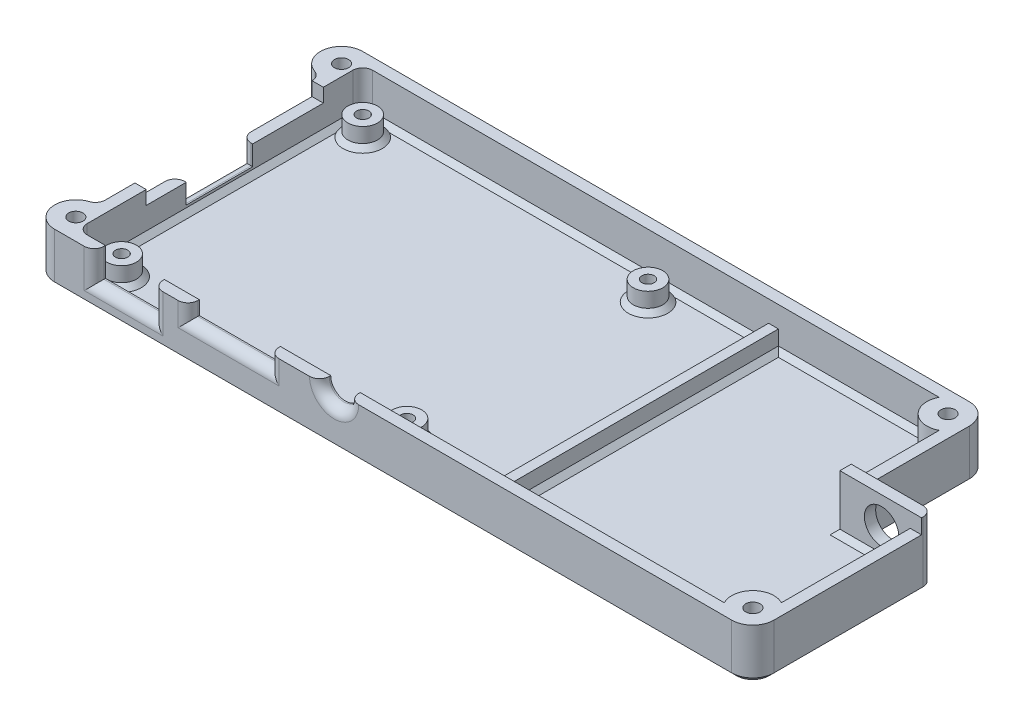
from build123d import *

# Parameters (mm, degrees)
BOSS_EXTRUDE1_DEPTH            = 10.3
BOSS_EXTRUDE2_DEPTH            = 2
SKETCH6_R                      = 3
BOSS_EXTRUDE3_DEPTH            = 4
F_2_5_2_5_DIAMETER_HOLE1_D     = 2.5
F_2_5_2_5_DIAMETER_HOLE1_DEPTH = 8
F_2_5_2_5_DIAMETER_HOLE1_TIP   = 0.751075774
SKETCH10_W                     = 2
SKETCH10_H                     = 58
BOSS_EXTRUDE4_DEPTH            = 4
CUT_EXTRUDE1_REACH             = 100.128
SKETCH11_R                     = 3
SKETCH11_W                     = 12
SKETCH11_H                     = 5.8
SKETCH11_W_2                   = 16.5
SKETCH11_H_2                   = 2.8
CUT_EXTRUDE2_REACH             = 148.374
SKETCH12_W                     = 13.5
SKETCH12_H                     = 6.8
SKETCH12_W_2                   = 36
SKETCH12_H_2                   = 2.8
FILLET6_R                      = 2
FILLET8_R                      = 2
CHAMFER1_SIZE                  = 1
FILLET9_R                      = 2
SKETCH14_W                     = 16.6
SKETCH14_H                     = 2.3
BOSS_EXTRUDE5_DEPTH            = 3
CUT_EXTRUDE3_REACH             = 86.384
SKETCH13_R                     = 3.5
BOSS_EXTRUDE6_DEPTH            = 10.3
F_2_9_2_9_DIAMETER_HOLE2_D     = 2.9
F_2_9_2_9_DIAMETER_HOLE1_D     = 2.9
BOSS_EXTRUDE7_REACH            = 89.052
SKETCH24_R                     = 4.3
F_2_9_2_9_DIAMETER_HOLE3_D     = 2.9
F_2_9_2_9_DIAMETER_HOLE4_D     = 2.9
FILLET10_R                     = 4.3
FILLET16_R                     = 4.3
FILLET17_R                     = 2
FILLET18_R                     = 2
CHAMFER3_SIZE                  = 1
FILLET19_R                     = 2


with BuildPart() as part:
    # Sketch3 → Boss-Extrude1 (new body)
    with BuildSketch(Plane(origin=(0, 0, 0), x_dir=(1, 0, 0), z_dir=(0, 1, 0))):
        Polygon((52.738233838, 8.405993834), (67.038233838, 8.405993834), (67.038233838, -28.194006166), (52.738233838, -28.194006166), (-74.861766162, -28.194006166), (-74.861766162, 34.405993834), (52.738233838, 34.405993834), align=None)
        Polygon((55.038233838, -25.894006166), (64.738233838, -25.894006166), (64.738233838, 6.105993834), (50.438233838, 6.105993834), (50.438233838, 32.105993834), (-72.561766162, 32.105993834), (-72.561766162, -25.894006166), (50.438233838, -25.894006166), align=None, mode=Mode.SUBTRACT)
    extrude(amount=BOSS_EXTRUDE1_DEPTH)

    # Sketch5 → Boss-Extrude2 (add)
    with BuildSketch(Plane(origin=(0, 0, 0), x_dir=(1, 0, 0), z_dir=(0, 1, 0))):
        Polygon((-72.561766162, 32.105993834), (50.438233838, 32.105993834), (50.438233838, 6.105993834), (64.738233838, 6.105993834), (64.738233838, -25.894006166), (50.438233838, -25.894006166), (-72.561766162, -25.894006166), align=None)
    extrude(amount=BOSS_EXTRUDE2_DEPTH)

    # Sketch6 → Boss-Extrude3 (add)
    with BuildSketch(Plane(origin=(0, 2, 0), x_dir=(1, 0, 0), z_dir=(0, 1, 0))):
        with Locations(Location((-68.061766162, 27.605993834, 0), (0, 0, 270))):
            Circle(SKETCH6_R)
        with Locations(Location((-68.061766162, -21.394006166, 0), (0, 0, 270))):
            Circle(SKETCH6_R)
        with Locations(Location((-10.061766162, -21.394006166, 0), (0, 0, 270))):
            Circle(SKETCH6_R)
        with Locations(Location((-10.061766162, 27.605993834, 0), (0, 0, 270))):
            Circle(SKETCH6_R)
    extrude(amount=BOSS_EXTRUDE3_DEPTH)

    # Ø2.5 (2.5) Diameter Hole1
    with Locations(Plane(origin=(0, 6, 0), x_dir=(1, 0, 0), z_dir=(0, 1, 0))):
        with Locations((-68.061766162, 27.605993834), (-10.061766162, 27.605993834), (-10.061766162, -21.394006166), (-68.061766162, -21.394006166)):
            Hole(F_2_5_2_5_DIAMETER_HOLE1_D / 2, depth=F_2_5_2_5_DIAMETER_HOLE1_DEPTH)
            with Locations((0, 0, -(F_2_5_2_5_DIAMETER_HOLE1_DEPTH + F_2_5_2_5_DIAMETER_HOLE1_TIP / 2))):  # 118° drill point
                Cone(0, F_2_5_2_5_DIAMETER_HOLE1_D / 2, F_2_5_2_5_DIAMETER_HOLE1_TIP, mode=Mode.SUBTRACT)

    # Sketch10 → Boss-Extrude4 (add)
    with BuildSketch(Plane(origin=(0, 2, 0), x_dir=(1, 0, 0), z_dir=(0, 1, 0))):
        with Locations((10.938233838, 3.105993834)):
            Rectangle(SKETCH10_W, SKETCH10_H)
    extrude(amount=BOSS_EXTRUDE4_DEPTH)

    # Sketch11 → Cut-Extrude1 (cut, up to next)
    with BuildSketch(Plane.XY.offset(28.194006166), mode=Mode.PRIVATE) as cut_extrude1_sk1:
        with Locations((-18.061766162, 10.3)):
            Circle(SKETCH11_R)
    cut_extrude1_tool1 = extrude(cut_extrude1_sk1.sketch, amount=-CUT_EXTRUDE1_REACH, mode=Mode.PRIVATE) & part.part
    # Sketch11 → Cut-Extrude1 (cut, up to next)
    with BuildSketch(Plane.XY.offset(28.194006166), mode=Mode.PRIVATE) as cut_extrude1_sk2:
        with Locations((-60.861766162, 7.4)):
            Rectangle(SKETCH11_W, SKETCH11_H)
    cut_extrude1_tool2 = extrude(cut_extrude1_sk2.sketch, amount=-CUT_EXTRUDE1_REACH, mode=Mode.PRIVATE) & part.part
    # Sketch11 → Cut-Extrude1 (cut, up to next)
    with BuildSketch(Plane.XY.offset(28.194006166), mode=Mode.PRIVATE) as cut_extrude1_sk3:
        with Locations((-39.527982648, 8.9)):
            Rectangle(SKETCH11_W_2, SKETCH11_H_2)
    cut_extrude1_tool3 = extrude(cut_extrude1_sk3.sketch, amount=-CUT_EXTRUDE1_REACH, mode=Mode.PRIVATE) & part.part
    add(cut_extrude1_tool1.solids().sort_by_distance((-18.061766, 10.3, 28.194006))[0], mode=Mode.SUBTRACT)
    add(cut_extrude1_tool2.solids().sort_by_distance((-60.861766, 7.4, 28.194006))[0], mode=Mode.SUBTRACT)
    add(cut_extrude1_tool3.solids().sort_by_distance((-39.527983, 8.9, 28.194006))[0], mode=Mode.SUBTRACT)

    # Sketch12 → Cut-Extrude2 (cut, up to next)
    with BuildSketch(Plane.ZY.offset(74.861766162), mode=Mode.PRIVATE) as cut_extrude2_sk1:
        with Locations((-2.982922372, 6.9)):
            Rectangle(SKETCH12_W, SKETCH12_H)
    cut_extrude2_tool1 = extrude(cut_extrude2_sk1.sketch, amount=-CUT_EXTRUDE2_REACH, mode=Mode.PRIVATE) & part.part
    # Sketch12 → Cut-Extrude2 (cut, up to next)
    with BuildSketch(Plane.ZY.offset(74.861766162), mode=Mode.PRIVATE) as cut_extrude2_sk2:
        with Locations((-6.105993834, 8.9)):
            Rectangle(SKETCH12_W_2, SKETCH12_H_2)
    cut_extrude2_tool2 = extrude(cut_extrude2_sk2.sketch, amount=-CUT_EXTRUDE2_REACH, mode=Mode.PRIVATE) & part.part
    add(cut_extrude2_tool1.solids().sort_by_distance((-74.861766, 6.9, -2.982922))[0], mode=Mode.SUBTRACT)
    add(cut_extrude2_tool2.solids().sort_by_distance((-74.861766, 8.9, -6.105994))[0], mode=Mode.SUBTRACT)

    # Fillet6
    fillet6_edges = [part.edges().sort_by_distance(p)[0] for p in [
        (50.438233838, 6.15, -32.105993834),
    ]]
    fillet(fillet6_edges, radius=FILLET6_R)

    # Fillet8
    fillet8_edges = [part.edges().sort_by_distance(p)[0] for p in [
        (-72.561766162, 6.15, -32.105993834),
        (-72.561766162, 6.15, 25.894006166),
    ]]
    fillet(fillet8_edges, radius=FILLET8_R)

    # Chamfer1
    chamfer1_edges = [part.edges().sort_by_distance(p)[0] for p in [
        (-68.061766162, 2, -30.605993834),
        (-68.061766162, 2, 18.394006166),
        (-10.061766162, 2, 18.394006166),
        (-10.061766162, 2, -30.605993834),
    ]]
    chamfer(chamfer1_edges, length=CHAMFER1_SIZE)

    # Chamfer2
    # the kernel refuses this chamfer: 1 mm, written as the material it adds along each edge
    with BuildSketch(Plane(origin=(64.738233838, 2, 25.894006166), x_dir=(0, 0.9996219169112968, 0.027495876610585623), z_dir=(-1, 0, 0))) as chamfer2_piece_1:
        with BuildLine():
            Line((1.028673195, 0), (-0.056547155, 1.027117794))
            Line((-0.056547155, 1.027117794), (-0.076539593, 1.026567876))
            ThreePointArc((-0.076539593, 1.026567876), (-0.034129227, 0.51339783), (-0.019992438, -0.000549918))
            Line((-0.019992438, -0.000549918), (0.000549918, -0.019992438))
            ThreePointArc((0.000549918, -0.019992438), (0.514497665, -0.00585565), (1.029223113, -0.019992438))
            Line((1.029223113, -0.019992438), (1.028673195, 0))
        make_face()
    extrude(amount=52.8)
    with BuildSketch(Plane(origin=(-70.561766162, 2, -32.105993834), x_dir=(0, -0.027495876610586296, 0.9996219169112968), z_dir=(1, 0, 0)), Plane(origin=(9.938233838, 2, 25.894006166), x_dir=(0, -0.02749587661058759, -0.9996219169112968), z_dir=(-1, 0, 0))) as chamfer2_piece_2:
        with BuildLine():
            Line((1.028673195, 0), (-0.056547155, -1.027117794))
            Line((-0.056547155, -1.027117794), (-0.076539593, -1.026567876))
            ThreePointArc((-0.076539593, -1.026567876), (-0.034129227, -0.51339783), (-0.019992438, 0.000549918))
            Line((-0.019992438, 0.000549918), (0.000549918, 0.019992438))
            ThreePointArc((0.000549918, 0.019992438), (0.514497665, 0.00585565), (1.029223113, 0.019992438))
            Line((1.029223113, 0.019992438), (1.028673195, 0))
        make_face()
    extrude(amount=80.5)
    with BuildSketch(Plane(origin=(9.938233838, 2, 25.894006166), x_dir=(-0.9996219169112968, -0.027495876610586556, 0), z_dir=(0, 0, -1))) as chamfer2_piece_3:
        with BuildLine():
            Line((1.028673195, 0), (-0.056547155, 1.027117794))
            Line((-0.056547155, 1.027117794), (-0.076539593, 1.026567876))
            ThreePointArc((-0.076539593, 1.026567876), (-0.034129227, 0.51339783), (-0.019992438, -0.000549918))
            Line((-0.019992438, -0.000549918), (0.000549918, -0.019992438))
            ThreePointArc((0.000549918, -0.019992438), (0.514497665, -0.00585565), (1.029223113, -0.019992438))
            Line((1.029223113, -0.019992438), (1.028673195, 0))
        make_face()
    extrude(amount=58)
    with BuildSketch(Plane(origin=(11.938233838, 2, -32.105993834), x_dir=(-0.027495876610585623, 0.9996219169112968, 0), z_dir=(0, 0, 1))) as chamfer2_piece_4:
        with BuildLine():
            Line((1.028673195, 0), (-0.056547155, -1.027117794))
            Line((-0.056547155, -1.027117794), (-0.076539593, -1.026567876))
            ThreePointArc((-0.076539593, -1.026567876), (-0.034129227, -0.51339783), (-0.019992438, 0.000549918))
            Line((-0.019992438, 0.000549918), (0.000549918, 0.019992438))
            ThreePointArc((0.000549918, 0.019992438), (0.514497665, 0.00585565), (1.029223113, 0.019992438))
            Line((1.029223113, 0.019992438), (1.028673195, 0))
        make_face()
    extrude(amount=58)
    with BuildSketch(Plane(origin=(11.938233838, 2, -32.105993834), x_dir=(0, 0.999621916911297, -0.027495876610582174), z_dir=(1, 0, 0))) as chamfer2_piece_5:
        with BuildLine():
            Line((1.028673195, 0), (-0.056547155, 1.027117794))
            Line((-0.056547155, 1.027117794), (-0.076539593, 1.026567876))
            ThreePointArc((-0.076539593, 1.026567876), (-0.034129227, 0.51339783), (-0.019992438, -0.000549918))
            Line((-0.019992438, -0.000549918), (0.000549918, -0.019992438))
            ThreePointArc((0.000549918, -0.019992438), (0.514497665, -0.00585565), (1.029223113, -0.019992438))
            Line((1.029223113, -0.019992438), (1.028673195, 0))
        make_face()
    extrude(amount=36.5)
    with BuildSketch(Plane(origin=(48.438233838, 2, -30.105993834), x_dir=(0, 0, -1), z_dir=(-1, 0, 0))) as chamfer2_piece_6:
        with BuildLine():
            Line((0.971715729, 0.028284271), (2.028284271, -1.028284271))
            Line((2.028284271, -1.028284271), (2.048284271, -1.028284271))
            ThreePointArc((2.048284271, -1.028284271), (2.02, -0.514142136), (2.02, 0))
            Line((2.02, 0), (2, 0.02))
            ThreePointArc((2, 0.02), (1.485857864, 0.02), (0.971715729, 0.048284271))
            Line((0.971715729, 0.048284271), (0.971715729, 0.028284271))
        make_face()
    revolve(axis=Axis((48.438233838, 2, -30.105993834), (0, -1, 0)), revolution_arc=90)
    with BuildSketch(Plane(origin=(-72.561766162, 2, 23.894006166), x_dir=(0.9996219169112968, -0.027495876610586605, 0), z_dir=(0, 0, -1))) as chamfer2_piece_7:
        with BuildLine():
            Line((1.028673195, 0), (-0.056547155, -1.027117794))
            Line((-0.056547155, -1.027117794), (-0.076539593, -1.026567876))
            ThreePointArc((-0.076539593, -1.026567876), (-0.034129227, -0.51339783), (-0.019992438, 0.000549918))
            Line((-0.019992438, 0.000549918), (0.000549918, 0.019992438))
            ThreePointArc((0.000549918, 0.019992438), (0.514497665, 0.00585565), (1.029223113, 0.019992438))
            Line((1.029223113, 0.019992438), (1.028673195, 0))
        make_face()
    extrude(amount=54)
    with BuildSketch(Plane(origin=(-70.561766162, 2, -30.105993834), x_dir=(0, 0, -1), z_dir=(1, 0, 0))) as chamfer2_piece_8:
        with BuildLine():
            Line((0.971715729, -0.028284271), (2.028284271, 1.028284271))
            Line((2.028284271, 1.028284271), (2.048284271, 1.028284271))
            ThreePointArc((2.048284271, 1.028284271), (2.02, 0.514142136), (2.02, 0))
            Line((2.02, 0), (2, -0.02))
            ThreePointArc((2, -0.02), (1.485857864, -0.02), (0.971715729, -0.048284271))
            Line((0.971715729, -0.048284271), (0.971715729, -0.028284271))
        make_face()
    revolve(axis=Axis((-70.561766162, 2, -30.105993834), (0, 1, 0)), revolution_arc=90)
    with BuildSketch(Plane(origin=(-70.561766162, 2, 23.894006166), x_dir=(-1, 0, 0), z_dir=(0, 0, -1))) as chamfer2_piece_9:
        with BuildLine():
            Line((0.971715729, -0.028284271), (2.028284271, 1.028284271))
            Line((2.028284271, 1.028284271), (2.048284271, 1.028284271))
            ThreePointArc((2.048284271, 1.028284271), (2.02, 0.514142136), (2.02, 0))
            Line((2.02, 0), (2, -0.02))
            ThreePointArc((2, -0.02), (1.485857864, -0.02), (0.971715729, -0.048284271))
            Line((0.971715729, -0.048284271), (0.971715729, -0.028284271))
        make_face()
    revolve(axis=Axis((-70.561766162, 2, 23.894006166), (0, 1, 0)), revolution_arc=90)
    with BuildSketch(Plane(origin=(64.738233838, 2, -6.105993834), x_dir=(-0.9996219169112968, -0.027495876610586008, 0), z_dir=(0, 0, 1))) as chamfer2_piece_10:
        with BuildLine():
            Line((1.028673195, 0), (-0.056547155, -1.027117794))
            Line((-0.056547155, -1.027117794), (-0.076539593, -1.026567876))
            ThreePointArc((-0.076539593, -1.026567876), (-0.034129227, -0.51339783), (-0.019992438, 0.000549918))
            Line((-0.019992438, 0.000549918), (0.000549918, 0.019992438))
            ThreePointArc((0.000549918, 0.019992438), (0.514497665, 0.00585565), (1.029223113, 0.019992438))
            Line((1.029223113, 0.019992438), (1.028673195, 0))
        make_face()
    extrude(amount=32)
    with BuildSketch(Plane(origin=(50.438233838, 2, -6.105993834), x_dir=(0, -0.02749587661058627, 0.9996219169112968), z_dir=(1, 0, 0))) as chamfer2_piece_11:
        with BuildLine():
            Line((1.028673195, 0), (-0.056547155, -1.027117794))
            Line((-0.056547155, -1.027117794), (-0.076539593, -1.026567876))
            ThreePointArc((-0.076539593, -1.026567876), (-0.034129227, -0.51339783), (-0.019992438, 0.000549918))
            Line((-0.019992438, 0.000549918), (0.000549918, 0.019992438))
            ThreePointArc((0.000549918, 0.019992438), (0.514497665, 0.00585565), (1.029223113, 0.019992438))
            Line((1.029223113, 0.019992438), (1.028673195, 0))
        make_face()
    extrude(amount=14.3)
    with BuildSketch(Plane(origin=(50.438233838, 2, -30.105993834), x_dir=(-0.9996219169112968, -0.0274958766105862, 0), z_dir=(0, 0, 1))) as chamfer2_piece_12:
        with BuildLine():
            Line((1.028673195, 0), (-0.056547155, -1.027117794))
            Line((-0.056547155, -1.027117794), (-0.076539593, -1.026567876))
            ThreePointArc((-0.076539593, -1.026567876), (-0.034129227, -0.51339783), (-0.019992438, 0.000549918))
            Line((-0.019992438, 0.000549918), (0.000549918, 0.019992438))
            ThreePointArc((0.000549918, 0.019992438), (0.514497665, 0.00585565), (1.029223113, 0.019992438))
            Line((1.029223113, 0.019992438), (1.028673195, 0))
        make_face()
    extrude(amount=24)
    with BuildSketch(Plane(origin=(67.309916826, 2, 25.894006166), x_dir=(0, 0.9996219169112968, 0.027495876610585623), z_dir=(-1, 0, 0))) as chamfer2_piece_13a_section:
        with BuildLine():
            Line((1.028673195, 0), (-0.056547155, 1.027117794))
            Line((-0.056547155, 1.027117794), (-0.076539593, 1.026567876))
            ThreePointArc((-0.076539593, 1.026567876), (-0.034129227, 0.51339783), (-0.019992438, -0.000549918))
            Line((-0.019992438, -0.000549918), (0.000549918, -0.019992438))
            ThreePointArc((0.000549918, -0.019992438), (0.514497665, -0.00585565), (1.029223113, -0.019992438))
            Line((1.029223113, -0.019992438), (1.028673195, 0))
        make_face()
    chamfer2_piece_13a = extrude(amount=55.371682988, mode=Mode.PRIVATE)
    chamfer2_piece_13a = split(chamfer2_piece_13a, bisect_by=Plane(origin=(64.738233838, 2.329793627, 25.564212539), z_dir=(1, 0, 0)), keep=Keep.TOP, mode=Mode.PRIVATE)
    with BuildSketch(Plane(origin=(64.738233838, 2, -6.105993834), x_dir=(-0.9996219169112968, -0.027495876610586008, 0), z_dir=(0, 0, 1))) as chamfer2_piece_13b_section:
        with BuildLine():
            Line((1.028673195, 0), (-0.056547155, -1.027117794))
            Line((-0.056547155, -1.027117794), (-0.076539593, -1.026567876))
            ThreePointArc((-0.076539593, -1.026567876), (-0.034129227, -0.51339783), (-0.019992438, 0.000549918))
            Line((-0.019992438, 0.000549918), (0.000549918, 0.019992438))
            ThreePointArc((0.000549918, 0.019992438), (0.514497665, 0.00585565), (1.029223113, 0.019992438))
            Line((1.029223113, 0.019992438), (1.028673195, 0))
        make_face()
    chamfer2_piece_13b = extrude(amount=34.571682988, mode=Mode.PRIVATE)
    chamfer2_piece_13b = split(chamfer2_piece_13b, bisect_by=Plane(origin=(64.408440211, 2.329793627, 25.894006166), z_dir=(0, 0, 1)), keep=Keep.TOP, mode=Mode.PRIVATE)
    chamfer2_piece_13 = chamfer2_piece_13a & chamfer2_piece_13b
    add(chamfer2_piece_13)
    with BuildSketch(Plane(origin=(64.738233838, 2, 25.894006166), x_dir=(0, 0.9996219169112968, 0.027495876610585623), z_dir=(-1, 0, 0))) as chamfer2_piece_14a_section:
        with BuildLine():
            Line((1.028673195, 0), (-0.056547155, 1.027117794))
            Line((-0.056547155, 1.027117794), (-0.076539593, 1.026567876))
            ThreePointArc((-0.076539593, 1.026567876), (-0.034129227, 0.51339783), (-0.019992438, -0.000549918))
            Line((-0.019992438, -0.000549918), (0.000549918, -0.019992438))
            ThreePointArc((0.000549918, -0.019992438), (0.514497665, -0.00585565), (1.029223113, -0.019992438))
            Line((1.029223113, -0.019992438), (1.028673195, 0))
        make_face()
    chamfer2_piece_14a = extrude(amount=55.371682988, mode=Mode.PRIVATE)
    chamfer2_piece_14a = split(chamfer2_piece_14a, bisect_by=Plane(origin=(11.938233838, 2.329793627, 25.564212539), z_dir=(-1, 0, 0)), keep=Keep.TOP, mode=Mode.PRIVATE)
    with BuildSketch(Plane(origin=(11.938233838, 2, -32.105993834), x_dir=(-0.027495876610585623, 0.9996219169112968, 0), z_dir=(0, 0, 1))) as chamfer2_piece_14b_section:
        with BuildLine():
            Line((1.028673195, 0), (-0.056547155, -1.027117794))
            Line((-0.056547155, -1.027117794), (-0.076539593, -1.026567876))
            ThreePointArc((-0.076539593, -1.026567876), (-0.034129227, -0.51339783), (-0.019992438, 0.000549918))
            Line((-0.019992438, 0.000549918), (0.000549918, 0.019992438))
            ThreePointArc((0.000549918, 0.019992438), (0.514497665, 0.00585565), (1.029223113, 0.019992438))
            Line((1.029223113, 0.019992438), (1.028673195, 0))
        make_face()
    chamfer2_piece_14b = extrude(amount=60.571682988, mode=Mode.PRIVATE)
    chamfer2_piece_14b = split(chamfer2_piece_14b, bisect_by=Plane(origin=(12.268027465, 2.329793627, 25.894006166), z_dir=(0, 0, 1)), keep=Keep.TOP, mode=Mode.PRIVATE)
    chamfer2_piece_14 = chamfer2_piece_14a & chamfer2_piece_14b
    add(chamfer2_piece_14)
    with BuildSketch(Plane(origin=(-70.561766162, 2, -32.105993834), x_dir=(0, -0.027495876610586296, 0.9996219169112968), z_dir=(1, 0, 0))) as chamfer2_piece_15a_section:
        with BuildLine():
            Line((1.028673195, 0), (-0.056547155, -1.027117794))
            Line((-0.056547155, -1.027117794), (-0.076539593, -1.026567876))
            ThreePointArc((-0.076539593, -1.026567876), (-0.034129227, -0.51339783), (-0.019992438, 0.000549918))
            Line((-0.019992438, 0.000549918), (0.000549918, 0.019992438))
            ThreePointArc((0.000549918, 0.019992438), (0.514497665, 0.00585565), (1.029223113, 0.019992438))
            Line((1.029223113, 0.019992438), (1.028673195, 0))
        make_face()
    chamfer2_piece_15a = extrude(amount=83.071682988, mode=Mode.PRIVATE)
    chamfer2_piece_15a = split(chamfer2_piece_15a, bisect_by=Plane(origin=(9.938233838, 2.329793627, -31.776200208), z_dir=(1, 0, 0)), keep=Keep.TOP, mode=Mode.PRIVATE)
    with BuildSketch(Plane(origin=(9.938233838, 2, 25.894006166), x_dir=(-0.9996219169112968, -0.027495876610586556, 0), z_dir=(0, 0, -1))) as chamfer2_piece_15b_section:
        with BuildLine():
            Line((1.028673195, 0), (-0.056547155, 1.027117794))
            Line((-0.056547155, 1.027117794), (-0.076539593, 1.026567876))
            ThreePointArc((-0.076539593, 1.026567876), (-0.034129227, 0.51339783), (-0.019992438, -0.000549918))
            Line((-0.019992438, -0.000549918), (0.000549918, -0.019992438))
            ThreePointArc((0.000549918, -0.019992438), (0.514497665, -0.00585565), (1.029223113, -0.019992438))
            Line((1.029223113, -0.019992438), (1.028673195, 0))
        make_face()
    chamfer2_piece_15b = extrude(amount=60.571682988, mode=Mode.PRIVATE)
    chamfer2_piece_15b = split(chamfer2_piece_15b, bisect_by=Plane(origin=(9.608440211, 2.329793627, -32.105993834), z_dir=(0, 0, -1)), keep=Keep.TOP, mode=Mode.PRIVATE)
    chamfer2_piece_15 = chamfer2_piece_15a & chamfer2_piece_15b
    add(chamfer2_piece_15)
    with BuildSketch(Plane(origin=(12.509916826, 2, 25.894006166), x_dir=(0, -0.027495876610586296, -0.9996219169112968), z_dir=(-1, 0, 0))) as chamfer2_piece_16a_section:
        with BuildLine():
            Line((1.028673195, 0), (-0.056547155, -1.027117794))
            Line((-0.056547155, -1.027117794), (-0.076539593, -1.026567876))
            ThreePointArc((-0.076539593, -1.026567876), (-0.034129227, -0.51339783), (-0.019992438, 0.000549918))
            Line((-0.019992438, 0.000549918), (0.000549918, 0.019992438))
            ThreePointArc((0.000549918, 0.019992438), (0.514497665, 0.00585565), (1.029223113, 0.019992438))
            Line((1.029223113, 0.019992438), (1.028673195, 0))
        make_face()
    chamfer2_piece_16a = extrude(amount=83.071682988, mode=Mode.PRIVATE)
    chamfer2_piece_16a = split(chamfer2_piece_16a, bisect_by=Plane(origin=(9.938233838, 2.329793627, 25.564212539), z_dir=(1, 0, 0)), keep=Keep.TOP, mode=Mode.PRIVATE)
    with BuildSketch(Plane(origin=(9.938233838, 2, 28.465689154), x_dir=(-0.9996219169112968, -0.02749587661058651, 0), z_dir=(0, 0, -1))) as chamfer2_piece_16b_section:
        with BuildLine():
            Line((1.028673195, 0), (-0.056547155, 1.027117794))
            Line((-0.056547155, 1.027117794), (-0.076539593, 1.026567876))
            ThreePointArc((-0.076539593, 1.026567876), (-0.034129227, 0.51339783), (-0.019992438, -0.000549918))
            Line((-0.019992438, -0.000549918), (0.000549918, -0.019992438))
            ThreePointArc((0.000549918, -0.019992438), (0.514497665, -0.00585565), (1.029223113, -0.019992438))
            Line((1.029223113, -0.019992438), (1.028673195, 0))
        make_face()
    chamfer2_piece_16b = extrude(amount=60.571682988, mode=Mode.PRIVATE)
    chamfer2_piece_16b = split(chamfer2_piece_16b, bisect_by=Plane(origin=(9.608440211, 2.329793627, 25.894006166), z_dir=(0, 0, 1)), keep=Keep.TOP, mode=Mode.PRIVATE)
    chamfer2_piece_16 = chamfer2_piece_16a & chamfer2_piece_16b
    add(chamfer2_piece_16)
    with BuildSketch(Plane(origin=(9.36655085, 2, -32.105993834), x_dir=(0, 0.9996219169112968, -0.027495876610589075), z_dir=(1, 0, 0))) as chamfer2_piece_17a_section:
        with BuildLine():
            Line((1.028673195, 0), (-0.056547155, 1.027117794))
            Line((-0.056547155, 1.027117794), (-0.076539593, 1.026567876))
            ThreePointArc((-0.076539593, 1.026567876), (-0.034129227, 0.51339783), (-0.019992438, -0.000549918))
            Line((-0.019992438, -0.000549918), (0.000549918, -0.019992438))
            ThreePointArc((0.000549918, -0.019992438), (0.514497665, -0.00585565), (1.029223113, -0.019992438))
            Line((1.029223113, -0.019992438), (1.028673195, 0))
        make_face()
    chamfer2_piece_17a = extrude(amount=39.071682988, mode=Mode.PRIVATE)
    chamfer2_piece_17a = split(chamfer2_piece_17a, bisect_by=Plane(origin=(11.938233838, 2.329793627, -31.776200208), z_dir=(-1, 0, 0)), keep=Keep.TOP, mode=Mode.PRIVATE)
    with BuildSketch(Plane(origin=(11.938233838, 2, -34.677676822), x_dir=(-0.027495876610585623, 0.9996219169112968, 0), z_dir=(0, 0, 1))) as chamfer2_piece_17b_section:
        with BuildLine():
            Line((1.028673195, 0), (-0.056547155, -1.027117794))
            Line((-0.056547155, -1.027117794), (-0.076539593, -1.026567876))
            ThreePointArc((-0.076539593, -1.026567876), (-0.034129227, -0.51339783), (-0.019992438, 0.000549918))
            Line((-0.019992438, 0.000549918), (0.000549918, 0.019992438))
            ThreePointArc((0.000549918, 0.019992438), (0.514497665, 0.00585565), (1.029223113, 0.019992438))
            Line((1.029223113, 0.019992438), (1.028673195, 0))
        make_face()
    chamfer2_piece_17b = extrude(amount=60.571682988, mode=Mode.PRIVATE)
    chamfer2_piece_17b = split(chamfer2_piece_17b, bisect_by=Plane(origin=(12.268027465, 2.329793627, -32.105993834), z_dir=(0, 0, -1)), keep=Keep.TOP, mode=Mode.PRIVATE)
    chamfer2_piece_17 = chamfer2_piece_17a & chamfer2_piece_17b
    add(chamfer2_piece_17)
    with BuildSketch(Plane(origin=(50.438233838, 2, -6.105993834), x_dir=(0, -0.02749587661058627, 0.9996219169112968), z_dir=(1, 0, 0))) as chamfer2_piece_18a_section:
        with BuildLine():
            Line((1.028673195, 0), (-0.056547155, -1.027117794))
            Line((-0.056547155, -1.027117794), (-0.076539593, -1.026567876))
            ThreePointArc((-0.076539593, -1.026567876), (-0.034129227, -0.51339783), (-0.019992438, 0.000549918))
            Line((-0.019992438, 0.000549918), (0.000549918, 0.019992438))
            ThreePointArc((0.000549918, 0.019992438), (0.514497665, 0.00585565), (1.029223113, 0.019992438))
            Line((1.029223113, 0.019992438), (1.028673195, 0))
        make_face()
    chamfer2_piece_18a = extrude(amount=16.871682988, mode=Mode.PRIVATE)
    chamfer2_piece_18a = split(chamfer2_piece_18a, bisect_by=Plane(origin=(64.738233838, 2.329793627, -5.776200208), z_dir=(1, 0, 0)), keep=Keep.TOP, mode=Mode.PRIVATE)
    with BuildSketch(Plane(origin=(64.738233838, 2, -8.677676822), x_dir=(-0.9996219169112968, -0.027495876610586008, 0), z_dir=(0, 0, 1))) as chamfer2_piece_18b_section:
        with BuildLine():
            Line((1.028673195, 0), (-0.056547155, -1.027117794))
            Line((-0.056547155, -1.027117794), (-0.076539593, -1.026567876))
            ThreePointArc((-0.076539593, -1.026567876), (-0.034129227, -0.51339783), (-0.019992438, 0.000549918))
            Line((-0.019992438, 0.000549918), (0.000549918, 0.019992438))
            ThreePointArc((0.000549918, 0.019992438), (0.514497665, 0.00585565), (1.029223113, 0.019992438))
            Line((1.029223113, 0.019992438), (1.028673195, 0))
        make_face()
    chamfer2_piece_18b = extrude(amount=34.571682988, mode=Mode.PRIVATE)
    chamfer2_piece_18b = split(chamfer2_piece_18b, bisect_by=Plane(origin=(64.408440211, 2.329793627, -6.105993834), z_dir=(0, 0, -1)), keep=Keep.TOP, mode=Mode.PRIVATE)
    chamfer2_piece_18 = chamfer2_piece_18a & chamfer2_piece_18b
    add(chamfer2_piece_18)
    with BuildSketch(Plane(origin=(50.438233838, 2, -30.105993834), x_dir=(-0.9996219169112968, -0.0274958766105862, 0), z_dir=(0, 0, 1))) as chamfer2_piece_19a_section:
        with BuildLine():
            Line((1.028673195, 0), (-0.056547155, -1.027117794))
            Line((-0.056547155, -1.027117794), (-0.076539593, -1.026567876))
            ThreePointArc((-0.076539593, -1.026567876), (-0.034129227, -0.51339783), (-0.019992438, 0.000549918))
            Line((-0.019992438, 0.000549918), (0.000549918, 0.019992438))
            ThreePointArc((0.000549918, 0.019992438), (0.514497665, 0.00585565), (1.029223113, 0.019992438))
            Line((1.029223113, 0.019992438), (1.028673195, 0))
        make_face()
    chamfer2_piece_19a = extrude(amount=26.571682988, mode=Mode.PRIVATE)
    chamfer2_piece_19a = split(chamfer2_piece_19a, bisect_by=Plane(origin=(50.108440211, 2.329793627, -6.105993834), z_dir=(0, 0, 1)), keep=Keep.TOP, mode=Mode.PRIVATE)
    with BuildSketch(Plane(origin=(47.86655085, 2, -6.105993834), x_dir=(0, -0.02749587661058627, 0.9996219169112968), z_dir=(1, 0, 0))) as chamfer2_piece_19b_section:
        with BuildLine():
            Line((1.028673195, 0), (-0.056547155, -1.027117794))
            Line((-0.056547155, -1.027117794), (-0.076539593, -1.026567876))
            ThreePointArc((-0.076539593, -1.026567876), (-0.034129227, -0.51339783), (-0.019992438, 0.000549918))
            Line((-0.019992438, 0.000549918), (0.000549918, 0.019992438))
            ThreePointArc((0.000549918, 0.019992438), (0.514497665, 0.00585565), (1.029223113, 0.019992438))
            Line((1.029223113, 0.019992438), (1.028673195, 0))
        make_face()
    chamfer2_piece_19b = extrude(amount=16.871682988, mode=Mode.PRIVATE)
    chamfer2_piece_19b = split(chamfer2_piece_19b, bisect_by=Plane(origin=(50.438233838, 2.329793627, -5.776200208), z_dir=(-1, 0, 0)), keep=Keep.TOP, mode=Mode.PRIVATE)
    chamfer2_piece_19 = chamfer2_piece_19a & chamfer2_piece_19b
    add(chamfer2_piece_19)

    # Fillet9
    fillet9_edges = [part.edges().sort_by_distance(p)[0] for p in [
        (-60.861766162, 4.5, 28.194006166),
        (-54.861766162, 7.4, 28.194006166),
        (-47.777982648, 8.9, 28.194006166),
        (-39.527982648, 7.5, 28.194006166),
        (-31.277982648, 8.9, 28.194006166),
        (-18.061766162, 7.3, 28.194006166),
        (-74.861766162, 5.5, -9.732922372),
        (-74.861766162, 3.5, -2.982922372),
        (-74.861766162, 5.5, 3.767077628),
    ]]
    fillet(fillet9_edges, radius=FILLET9_R)

    # Sketch14 → Boss-Extrude5 (add)
    with BuildSketch(Plane(origin=(0, 10.3, 0), x_dir=(1, 0, 0), z_dir=(0, 1, 0))):
        with Locations((58.738233838, 7.255993834)):
            Rectangle(SKETCH14_W, SKETCH14_H)
    extrude(amount=BOSS_EXTRUDE5_DEPTH)

    # Sketch13 → Cut-Extrude3 (cut, up to next)
    with BuildSketch(Plane(origin=(0, 0, -8.405993834), x_dir=(-1, 0, 0), z_dir=(0, 0, -1)), mode=Mode.PRIVATE) as cut_extrude3_sk1:
        with Locations((-58.908959679, 7.722271929)):
            Circle(SKETCH13_R)
    cut_extrude3_tool1 = extrude(cut_extrude3_sk1.sketch, amount=-CUT_EXTRUDE3_REACH, mode=Mode.PRIVATE) & part.part
    add(cut_extrude3_tool1.solids().sort_by_distance((58.90896, 7.722272, -8.405994))[0], mode=Mode.SUBTRACT)

    # Sketch17 → Boss-Extrude6 (add)
    with BuildSketch(Plane(origin=(0, 0, 0), x_dir=(1, 0, 0), z_dir=(0, 1, 0))):
        with BuildLine():
            Line((-74.861766162, 34.405993834), (-74.861766162, 25.805993834))
            ThreePointArc((-74.861766162, 25.805993834), (-79.161766162, 30.105993834), (-74.861766162, 34.405993834))
        make_face()
        with BuildLine():
            Line((-74.861766162, -19.594006166), (-74.861766162, -28.194006166))
            ThreePointArc((-74.861766162, -28.194006166), (-79.161766162, -23.894006166), (-74.861766162, -19.594006166))
        make_face()
    extrude(amount=BOSS_EXTRUDE6_DEPTH)

    # Ø2.9 (2.9) Diameter Hole2 (through all)
    with Locations(Plane(origin=(0, 10.3, 0), x_dir=(1, 0, 0), z_dir=(0, 1, 0))):
        with Locations((-74.861766162, 30.105993834)):
            Hole(F_2_9_2_9_DIAMETER_HOLE2_D / 2)

    # Ø2.9 (2.9) Diameter Hole1 (through all)
    with Locations(Plane(origin=(0, 10.3, 0), x_dir=(1, 0, 0), z_dir=(0, 1, 0))):
        with Locations((-74.861766162, -23.894006166)):
            Hole(F_2_9_2_9_DIAMETER_HOLE1_D / 2)

    # Boss-Extrude7: up to this face of the body (flat: up to its plane)
    boss_extrude7_end = Plane(part.part.faces().sort_by_distance((-74.050055774, 10.3, 22.517680386))[0])
    # Sketch24 → Boss-Extrude7 (add, up to the picked face)
    with BuildSketch(Plane(origin=(0, 2, 0), x_dir=(1, 0, 0), z_dir=(0, 1, 0)), mode=Mode.PRIVATE) as boss_extrude7_sk1:
        with Locations((62.738431143, -23.885848487)):
            Circle(SKETCH24_R)
    boss_extrude7_tool1 = split(extrude(boss_extrude7_sk1.sketch, amount=BOSS_EXTRUDE7_REACH, mode=Mode.PRIVATE), bisect_by=boss_extrude7_end, keep=Keep.BOTH, mode=Mode.PRIVATE)
    # Sketch24 → Boss-Extrude7 (add, up to the picked face)
    with BuildSketch(Plane(origin=(0, 2, 0), x_dir=(1, 0, 0), z_dir=(0, 1, 0)), mode=Mode.PRIVATE) as boss_extrude7_sk2:
        with Locations((48.418494527, 30.105993834)):
            Circle(SKETCH24_R)
    boss_extrude7_tool2 = split(extrude(boss_extrude7_sk2.sketch, amount=BOSS_EXTRUDE7_REACH, mode=Mode.PRIVATE), bisect_by=boss_extrude7_end, keep=Keep.BOTH, mode=Mode.PRIVATE)
    add(boss_extrude7_tool1.solids().sort_by(Axis((62.738431, 2, 23.885848), (0, 1, 0)))[0])
    add(boss_extrude7_tool2.solids().sort_by(Axis((48.418495, 2, -30.105994), (0, 1, 0)))[0])

    # Ø2.9 (2.9) Diameter Hole3 (through all)
    with Locations(Plane(origin=(0, 10.3, 0), x_dir=(1, 0, 0), z_dir=(0, 1, 0))):
        with Locations((62.738431143, -23.885848487)):
            Hole(F_2_9_2_9_DIAMETER_HOLE3_D / 2)

    # Ø2.9 (2.9) Diameter Hole4 (through all)
    with Locations(Plane(origin=(0, 10.3, 0), x_dir=(1, 0, 0), z_dir=(0, 1, 0))):
        with Locations((48.418494527, 30.105993834)):
            Hole(F_2_9_2_9_DIAMETER_HOLE4_D / 2)

    # Fillet10
    fillet10_edges = [part.edges().sort_by_distance(p)[0] for p in [
        (52.738233838, 5.15, -34.405993834),
    ]]
    fillet(fillet10_edges, radius=FILLET10_R)

    # Fillet16
    # the kernel refuses this fillet: 4.3 mm, written as the material it takes off along each edge
    with BuildSketch(Plane(origin=(67.038233838, -10.75, 28.194006166), x_dir=(0, 0, -1), z_dir=(0, 1, 0))) as fillet16_piece_1:
        with BuildLine():
            CenterArc((FILLET16_R, FILLET16_R), FILLET16_R, 180, 90)
            Line((0, FILLET16_R), (0, 0))
            Line((0, 0), (FILLET16_R, 0))
        make_face()
    extrude(amount=31.8, mode=Mode.SUBTRACT)

    # Fillet17
    fillet17_edges = [part.edges().sort_by_distance(p)[0] for p in [
        (52.738233838, 5.15, -8.405993834),
        (67.038233838, 6.65, -8.405993834),
    ]]
    fillet(fillet17_edges, radius=FILLET17_R)

    # Fillet18
    fillet18_edges = [part.edges().sort_by_distance(p)[0] for p in [
        (-74.861766162, 5.15, -25.805993834),
        (-74.861766162, 5.15, 19.594006166),
    ]]
    fillet(fillet18_edges, radius=FILLET18_R)

    # Chamfer3
    chamfer3_edges = [part.edges().sort_by_distance(p)[0] for p in [
        (-79.105793795, 0, -30.797535193),
        (-13.211766162, 0, -34.405993834),
        (51.478792997, 0, -33.146552993),
        (67.038233838, 0, 8.744006166),
        (65.778792997, 0, 26.934565325),
        (52.738233838, 0, -20.255993834),
        (59.888233838, 0, -8.405993834),
        (66.4524474, 0, -7.820207397),
        (53.324020275, 0, -8.991780272),
        (-79.105793795, 0, 24.585547524),
        (-74.861766162, 0, -3.105993834),
        (-75.2385223, 0, 19.088261462),
        (-75.2385223, 0, -25.300249131),
        (-6.061766162, 0, 28.194006166),
    ]]
    chamfer(chamfer3_edges, length=CHAMFER3_SIZE)

    # Fillet19
    fillet19_edges = [part.edges().sort_by_distance(p)[0] for p in [
        (-66.861766162, 6.4, 28.194006166),
    ]]
    fillet(fillet19_edges, radius=FILLET19_R)


solid = part.part
